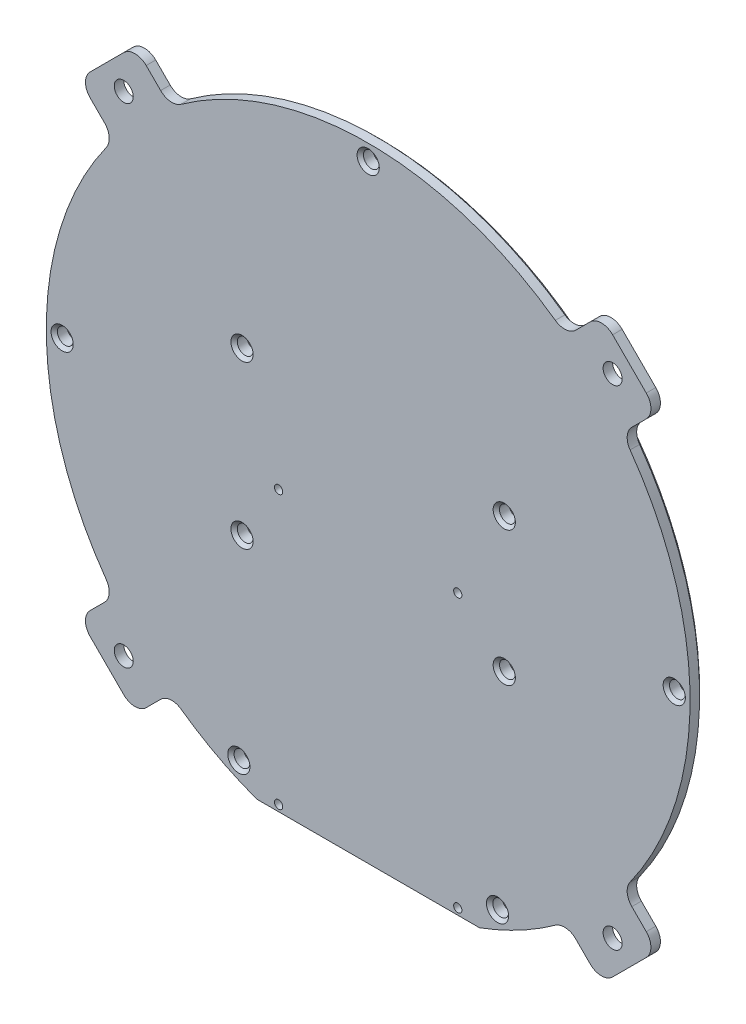
from build123d import *

# Parameters (mm, degrees)
ESBO_O1_R                = 2.5
ESBO_O1_W                = 61
ESBO_O1_H                = 90.5
ESBO_O1_R_2              = 1.3
RESSALTO_EXTRUS_O1_DEPTH = 4
ESBO_O1_4_W              = 61
ESBO_O1_4_H              = 90.5
ESBO_O1_4_R              = 1.3
CORTE_EXTRUS_O3_DEPTH    = 1.5
RESSALTO_EXTRUS_O3_START = -3
ESBO_O2_R                = 3
RESSALTO_EXTRUS_O3_DEPTH = 3
CHANFRO1_SIZE            = 1
CHANFRO2_SIZE            = 1


with BuildPart() as part:
    # Esboço1 → Ressalto-extrusão1 (new body)
    # profile 1 of 2: a face of its own
    with BuildSketch(Plane.XY):
        with BuildLine():
            Line((-35.106979363, -95.235235076), (-30.5, -95.235235076))
            Line((-30.5, -95.235235076), (-30.5, -4.735235076))
            Line((-30.5, -4.735235076), (30.5, -4.735235076))
            Line((30.5, -4.735235076), (30.5, -95.235235076))
            Line((30.5, -95.235235076), (35.106979363, -95.235235076))
            ThreePointArc((35.106979363, -95.235235076), (0, 101.5), (-35.106979363, -95.235235076))
        make_face()
        with Locations((-40.782662258, -87.458701449)):
            Circle(ESBO_O1_R, mode=Mode.SUBTRACT)
        with Locations((-96.5, 0)):
            Circle(ESBO_O1_R, mode=Mode.SUBTRACT)
        with Locations((-39.78606917, -25.45794308)):
            Circle(ESBO_O1_R, mode=Mode.SUBTRACT)
        with Locations((40.782662258, -87.458701449)):
            Circle(ESBO_O1_R, mode=Mode.SUBTRACT)
        with Locations((42.90493083, -21.30794308)):
            Circle(ESBO_O1_R, mode=Mode.SUBTRACT)
        with Locations((96.5, 0)):
            Circle(ESBO_O1_R, mode=Mode.SUBTRACT)
        with Locations((-39.78606917, 25.605133502)):
            Circle(ESBO_O1_R, mode=Mode.SUBTRACT)
        with Locations((42.90493083, 21.118210084)):
            Circle(ESBO_O1_R, mode=Mode.SUBTRACT)
        with Locations((0, 96.5)):
            Circle(ESBO_O1_R, mode=Mode.SUBTRACT)
    # profile 2 of 2: a face of its own
    with BuildSketch(Plane.XY):
        with Locations((0, -49.985235076)):
            Rectangle(ESBO_O1_W, ESBO_O1_H)
        with Locations((-28.25, -93.235235076)):
            Circle(ESBO_O1_R_2, mode=Mode.SUBTRACT)
        with Locations((-28.25, -7.235235076)):
            Circle(ESBO_O1_R_2, mode=Mode.SUBTRACT)
        with Locations((28.25, -93.235235076)):
            Circle(ESBO_O1_R_2, mode=Mode.SUBTRACT)
        with Locations((28.25, -7.235235076)):
            Circle(ESBO_O1_R_2, mode=Mode.SUBTRACT)
    extrude(amount=RESSALTO_EXTRUS_O1_DEPTH)

    # Esboço1<4> → Corte-extrusão3 (cut)
    with BuildSketch(Plane.XY):
        with Locations((0, -49.985235076)):
            Rectangle(ESBO_O1_4_W, ESBO_O1_4_H)
        with Locations((-28.25, -93.235235076)):
            Circle(ESBO_O1_4_R, mode=Mode.SUBTRACT)
        with Locations((-28.25, -7.235235076)):
            Circle(ESBO_O1_4_R, mode=Mode.SUBTRACT)
        with Locations((28.25, -93.235235076)):
            Circle(ESBO_O1_4_R, mode=Mode.SUBTRACT)
        with Locations((28.25, -7.235235076)):
            Circle(ESBO_O1_4_R, mode=Mode.SUBTRACT)
    extrude(amount=CORTE_EXTRUS_O3_DEPTH, mode=Mode.SUBTRACT)

    # Esboço2 → Ressalto-extrusão3 (add)
    # profile 1 of 4: a face of its own
    with BuildSketch(Plane.XY.offset(4).offset(RESSALTO_EXTRUS_O3_START)):
        with BuildLine():
            ThreePointArc((-59.002353185, -82.589177975), (-71.77133829, -71.77133829), (-82.589177975, -59.002353185))
            ThreePointArc((-82.589177975, -59.002353185), (-81.674630343, -62.321074298), (-83.122076482, -65.444406952))
            Line((-83.122076482, -65.444406952), (-87.681240867, -70.003571337))
            ThreePointArc((-87.681240867, -70.003571337), (-89.145706961, -73.539105243), (-87.681240867, -77.074639149))
            Line((-87.681240867, -77.074639149), (-82.377940008, -82.377940008))
            Line((-82.377940008, -82.377940008), (-77.074639149, -87.681240867))
            ThreePointArc((-77.074639149, -87.681240867), (-73.539105243, -89.145706961), (-70.003571337, -87.681240867))
            Line((-70.003571337, -87.681240867), (-65.444406952, -83.122076482))
            ThreePointArc((-65.444406952, -83.122076482), (-62.321074298, -81.674630343), (-59.002353185, -82.589177975))
        make_face()
        with Locations((-77.074639149, -77.074639149)):
            Circle(ESBO_O2_R, mode=Mode.SUBTRACT)
    # profile 2 of 4: a face of its own
    with BuildSketch(Plane.XY.offset(4).offset(RESSALTO_EXTRUS_O3_START)):
        with BuildLine():
            ThreePointArc((-82.589177975, 59.002353185), (-71.77133829, 71.77133829), (-59.002353185, 82.589177975))
            ThreePointArc((-59.002353185, 82.589177975), (-62.321074298, 81.674630343), (-65.444406952, 83.122076482))
            Line((-65.444406952, 83.122076482), (-70.003571337, 87.681240867))
            ThreePointArc((-70.003571337, 87.681240867), (-73.539105243, 89.145706961), (-77.074639149, 87.681240867))
            Line((-77.074639149, 87.681240867), (-82.377940008, 82.377940008))
            Line((-82.377940008, 82.377940008), (-87.681240867, 77.074639149))
            ThreePointArc((-87.681240867, 77.074639149), (-89.145706961, 73.539105243), (-87.681240867, 70.003571337))
            Line((-87.681240867, 70.003571337), (-83.122076482, 65.444406952))
            ThreePointArc((-83.122076482, 65.444406952), (-81.674630343, 62.321074298), (-82.589177975, 59.002353185))
        make_face()
        with Locations((-77.074639149, 77.074639149)):
            Circle(ESBO_O2_R, mode=Mode.SUBTRACT)
    # profile 3 of 4: a face of its own
    with BuildSketch(Plane.XY.offset(4).offset(RESSALTO_EXTRUS_O3_START)):
        with BuildLine():
            ThreePointArc((59.002353185, 82.589177975), (71.77133829, 71.77133829), (82.589177975, 59.002353185))
            ThreePointArc((82.589177975, 59.002353185), (81.674630343, 62.321074298), (83.122076482, 65.444406952))
            Line((83.122076482, 65.444406952), (87.681240867, 70.003571337))
            ThreePointArc((87.681240867, 70.003571337), (89.145706961, 73.539105243), (87.681240867, 77.074639149))
            Line((87.681240867, 77.074639149), (82.377940008, 82.377940008))
            Line((82.377940008, 82.377940008), (77.074639149, 87.681240867))
            ThreePointArc((77.074639149, 87.681240867), (73.539105243, 89.145706961), (70.003571337, 87.681240867))
            Line((70.003571337, 87.681240867), (65.444406952, 83.122076482))
            ThreePointArc((65.444406952, 83.122076482), (62.321074298, 81.674630343), (59.002353185, 82.589177975))
        make_face()
        with Locations((77.074639149, 77.074639149)):
            Circle(ESBO_O2_R, mode=Mode.SUBTRACT)
    # profile 4 of 4: a face of its own
    with BuildSketch(Plane.XY.offset(4).offset(RESSALTO_EXTRUS_O3_START)):
        with BuildLine():
            Line((77.074639149, -87.681240867), (82.377940008, -82.377940008))
            Line((82.377940008, -82.377940008), (87.681240867, -77.074639149))
            ThreePointArc((87.681240867, -77.074639149), (89.145706961, -73.539105243), (87.681240867, -70.003571337))
            Line((87.681240867, -70.003571337), (83.122076482, -65.444406952))
            ThreePointArc((83.122076482, -65.444406952), (81.674630343, -62.321074298), (82.589177975, -59.002353185))
            ThreePointArc((82.589177975, -59.002353185), (71.77133829, -71.77133829), (59.002353185, -82.589177975))
            ThreePointArc((59.002353185, -82.589177975), (62.321074298, -81.674630343), (65.444406952, -83.122076482))
            Line((65.444406952, -83.122076482), (70.003571337, -87.681240867))
            ThreePointArc((70.003571337, -87.681240867), (73.539105243, -89.145706961), (77.074639149, -87.681240867))
        make_face()
        with Locations((77.074639149, -77.074639149)):
            Circle(ESBO_O2_R, mode=Mode.SUBTRACT)
    extrude(amount=RESSALTO_EXTRUS_O3_DEPTH)

    # Chanfro1
    chanfro1_edges = [part.edges().sort_by_distance(p)[0] for p in [
        (-32.803489682, -95.235235076, 0),
        (0, 101.5, 0),
        (32.803489682, -95.235235076, 0),
    ]]
    chamfer(chanfro1_edges, length=CHANFRO1_SIZE - 0.0001)  # a hair under: the kernel refuses the full size

    # Chanfro2
    chanfro2_edges = [part.edges().sort_by_distance(p)[0] for p in [
        (38.282662258, -87.458701449, 4),
        (40.40493083, -21.30794308, 4),
        (94, 0, 4),
        (40.40493083, 21.118210084, 4),
        (-2.5, 96.5, 4),
        (-42.28606917, 25.605133502, 4),
        (-42.28606917, -25.45794308, 4),
        (-99, 0, 4),
        (-43.282662258, -87.458701449, 4),
    ]]
    chamfer(chanfro2_edges, length=CHANFRO2_SIZE)


solid = part.part
